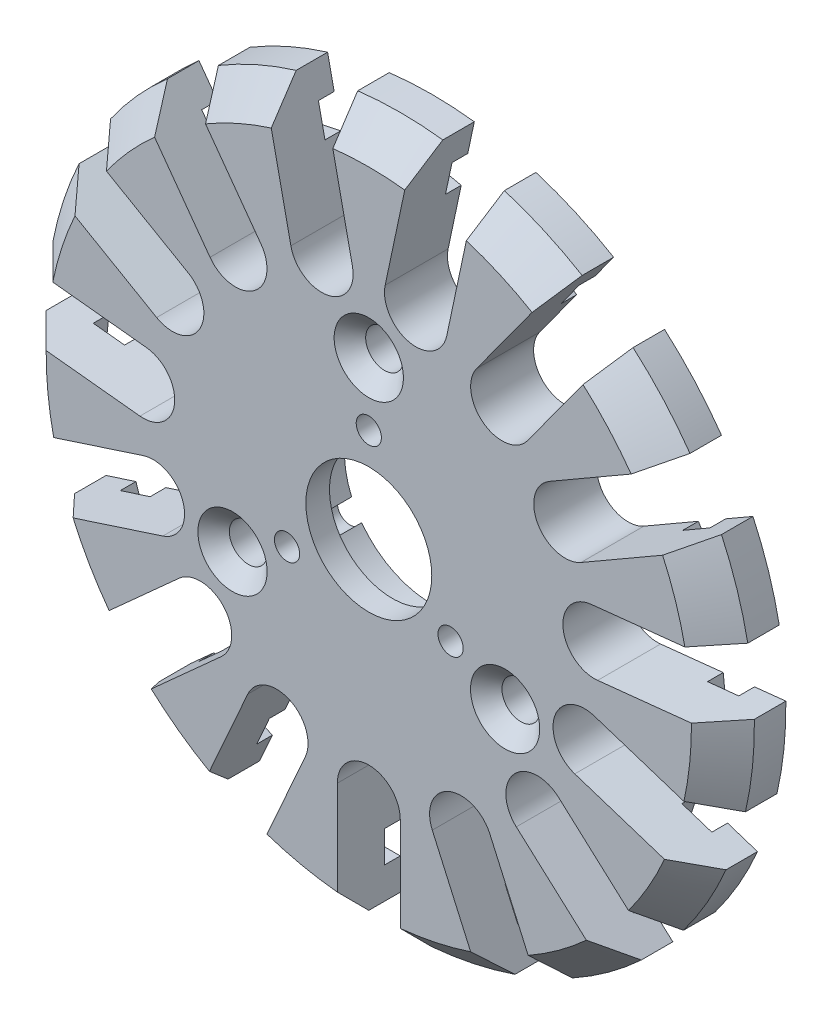
from build123d import *

# Parameters (mm, degrees)
ESBO_O1_R                                            = 22.5
RESSALTO_EXTRUS_O1_DEPTH                             = 4
CHANFRO1_SIZE                                        = 2
ESBO_O4_R                                            = 5.55
CORTE_EXTRUS_O2_DEPTH                                = 2.5
ESBO_O5_R                                            = 4
CORTE_EXTRUS_O3_DEPTH                                = 2
CORTE_EXTRUS_O4_DEPTH                                = 4
PADR_OCIRCULAR1_COUNT                                = 15
BROCA_DE_ROSQUEAR_PARA_TARRAXA_DE_M21_D              = 1.6
ESCAREADO_PARA_PARAFUSO_COM_CABE_A_ESCAR_D           = 2.4
ESCAREADO_PARA_PARAFUSO_COM_CABE_A_ESCAR_CSINK_D     = 4.4
ESCAREADO_PARA_PARAFUSO_COM_CABE_A_ESCAR_CSINK_ANGLE = 90
PADR_OCIRCULAR2_COUNT                                = 3
ESBO_O12_W                                           = 7
ESBO_O12_H                                           = 2
CORTE_EXTRUS_O5_DEPTH                                = 1
PADR_OCIRCULAR3_COUNT                                = 15
PADR_OCIRCULAR4_COUNT                                = 3


with BuildPart() as part:
    # Esboço1 → Ressalto-extrusão1 (new body)
    with BuildSketch(Plane.XY):
        Circle(ESBO_O1_R)
    extrude(amount=RESSALTO_EXTRUS_O1_DEPTH)

    # Chanfro1
    chanfro1_edges = [part.edges().sort_by_distance(p)[0] for p in [
        (-22.5, 0, 4),
    ]]
    chamfer(chanfro1_edges, length=CHANFRO1_SIZE)

    # Esboço4 → Corte-extrusão2 (cut)
    with BuildSketch(Plane(origin=(0, 0, 0), x_dir=(-1, 0, 0), z_dir=(0, 0, -1))):
        Circle(ESBO_O4_R)
    extrude(amount=-CORTE_EXTRUS_O2_DEPTH, mode=Mode.SUBTRACT)

    # Esboço5 → Corte-extrusão3 (cut)
    with BuildSketch(Plane(origin=(0, 0, 2.5), x_dir=(-1, 0, 0), z_dir=(0, 0, -1))):
        Circle(ESBO_O5_R)
    extrude(amount=-CORTE_EXTRUS_O3_DEPTH, mode=Mode.SUBTRACT)

    # Esboço6 → Corte-extrusão4 (cut)
    with BuildSketch(Plane(origin=(0, 0, 0), x_dir=(-1, 0, 0), z_dir=(0, 0, -1))):
        with BuildLine():
            Line((2, -22.410934831), (2, -14.410934831))
            ThreePointArc((2, -14.410934831), (0, -12.410934831), (-2, -14.410934831))
            Line((-2, -14.410934831), (-2, -22.410934831))
            ThreePointArc((-2, -22.410934831), (0, -22.5), (2, -22.410934831))
        make_face()
    corte_extrus_o4 = extrude(amount=-CORTE_EXTRUS_O4_DEPTH, mode=Mode.SUBTRACT)

    # PadrãoCircular1: Corte-extrusão4 ×15 about axis
    padr_ocircular1_axis = Axis((0, 0, 2.5), (0, 0, -1))
    for i in range(1, PADR_OCIRCULAR1_COUNT):
        add(corte_extrus_o4.rotate(padr_ocircular1_axis, i * 360 / PADR_OCIRCULAR1_COUNT), mode=Mode.SUBTRACT)

    # Broca de rosquear para tarraxa de M21 (through all)
    with Locations(Plane(origin=(0, 6, 4), x_dir=(1, 0, 0), z_dir=(0, 0, 1))):
        with Locations((0, 0)):
            broca_de_rosquear_para_tarraxa_de_m21 = Hole(BROCA_DE_ROSQUEAR_PARA_TARRAXA_DE_M21_D / 2)

    # Escareado para parafuso com cabeça escareada chata de M21 (through all)
    with Locations(Plane(origin=(0, 10, 4), x_dir=(1, 0, 0), z_dir=(0, 0, 1))):
        with Locations((0, 0)):
            escareado_para_parafuso_com_cabe_a_escar = CounterSinkHole(ESCAREADO_PARA_PARAFUSO_COM_CABE_A_ESCAR_D / 2, ESCAREADO_PARA_PARAFUSO_COM_CABE_A_ESCAR_CSINK_D / 2, counter_sink_angle=ESCAREADO_PARA_PARAFUSO_COM_CABE_A_ESCAR_CSINK_ANGLE)

    # PadrãoCircular2: Broca de rosquear para tarraxa de M21 ×3 about axis
    padr_ocircular2_axis = Axis((0, 0, 2.5), (0, 0, -1))
    for i in range(1, PADR_OCIRCULAR2_COUNT):
        add(broca_de_rosquear_para_tarraxa_de_m21.rotate(padr_ocircular2_axis, i * 360 / PADR_OCIRCULAR2_COUNT), mode=Mode.SUBTRACT)

    # Esboço12 → Corte-extrusão5 (cut)
    with BuildSketch(Plane(origin=(0, 0, 0), x_dir=(-1, 0, 0), z_dir=(0, 0, -1))):
        with Locations((0, -19.410934831)):
            Rectangle(ESBO_O12_W, ESBO_O12_H)
    corte_extrus_o5 = extrude(amount=-CORTE_EXTRUS_O5_DEPTH, mode=Mode.SUBTRACT)

    # PadrãoCircular3: Corte-extrusão5 ×15 about axis
    padr_ocircular3_axis = Axis((0, 0, 2.5), (0, 0, -1))
    for i in range(1, PADR_OCIRCULAR3_COUNT):
        add(corte_extrus_o5.rotate(padr_ocircular3_axis, i * 360 / PADR_OCIRCULAR3_COUNT), mode=Mode.SUBTRACT)

    # PadrãoCircular4: Escareado para parafuso com cabeça escareada chata de M21 ×3 about axis
    padr_ocircular4_axis = Axis((0, 0, 4), (0, 0, 1))
    for i in range(1, PADR_OCIRCULAR4_COUNT):
        add(escareado_para_parafuso_com_cabe_a_escar.rotate(padr_ocircular4_axis, i * 360 / PADR_OCIRCULAR4_COUNT), mode=Mode.SUBTRACT)


solid = part.part
